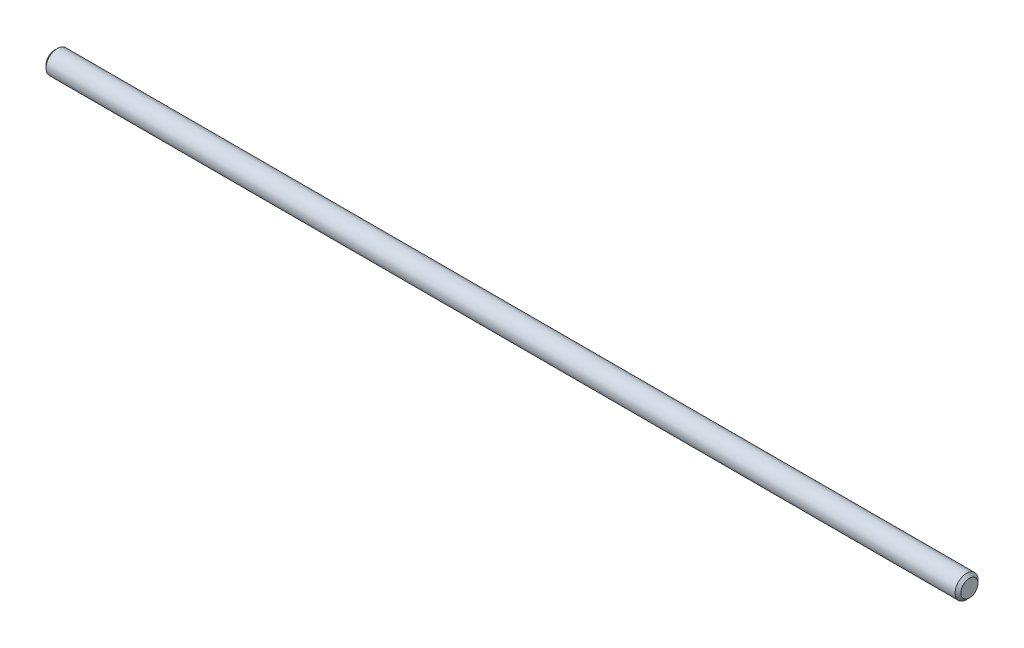
from build123d import *

# Parameters (mm, degrees)
SKETCH1_R           = 2
BOSS_EXTRUDE1_DEPTH = 80
CHAMFER1_SIZE       = 0.5


with BuildPart() as part:
    # Sketch1 → Boss-Extrude1 (new, symmetric)
    with BuildSketch(Plane(origin=(0, 0, 0), x_dir=(0, 0, -1), z_dir=(1, 0, 0))):
        Circle(SKETCH1_R)
    extrude(amount=BOSS_EXTRUDE1_DEPTH, both=True)

    # Chamfer1
    chamfer1_edges = [part.edges().sort_by_distance(p)[0] for p in [
        (80, 0, 2),
        (-80, 0, 2),
    ]]
    chamfer(chamfer1_edges, length=CHAMFER1_SIZE)


solid = part.part
